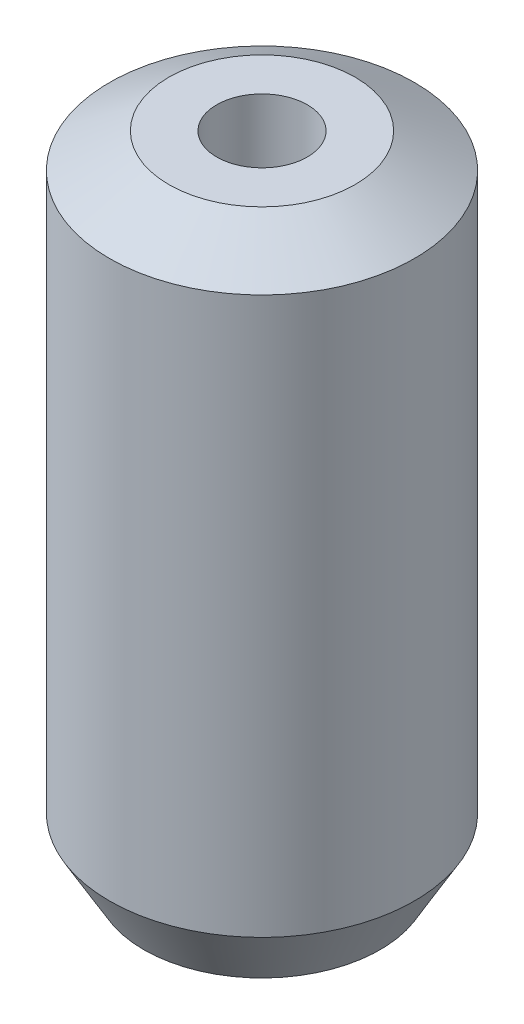
from build123d import *
from OCP.BRepFilletAPI import BRepFilletAPI_MakeChamfer

# Parameters (mm, degrees)
SKETCH1_R           = 12.5
BOSS_EXTRUDE1_DEPTH = 53.28529867
SKETCH2_R           = 3.714719022
CUT_EXTRUDE1_DEPTH  = 57.141099511
CHAMFER1_SIZE       = 2.810990905
CHAMFER1_SIZE2      = 4.868779068


with BuildPart() as part:
    # Sketch1 → Boss-Extrude1 (new body)
    with BuildSketch(Plane(origin=(0, 0, 0), x_dir=(1, 0, 0), z_dir=(0, 1, 0))):
        Circle(SKETCH1_R)
    extrude(amount=BOSS_EXTRUDE1_DEPTH)

    # Sketch2 → Cut-Extrude1 (cut, through all)
    with BuildSketch(Plane(origin=(0, 0, 0), x_dir=(1, 0, 0), z_dir=(0, 1, 0))):
        Circle(SKETCH2_R)
    extrude(amount=CUT_EXTRUDE1_DEPTH, mode=Mode.SUBTRACT)

    # Chamfer1: one chamfer whose edges measure the first distance from different faces: ONE call of the kernel's chamfer builder (chamfer() names one face for all edges)
    chamfer1_edges_1 = [part.edges().sort_by_distance(p)[0] for p in [
        (-12.5, 53.28529867, 0),
    ]]
    chamfer1_side_1 = [part.faces().sort_by_distance(p)[0] for p in [
        (-12.5, 26.642649335, 0),
    ]]
    chamfer1_edges_2 = [part.edges().sort_by_distance(p)[0] for p in [
        (-12.5, 0, 0),
    ]]
    chamfer1_side_2 = [part.faces().sort_by_distance(p)[0] for p in [
        (-12.146446609, 0, 0),
    ]]
    chamfer1 = BRepFilletAPI_MakeChamfer(part.part.solid().wrapped)
    for e in chamfer1_edges_1:
        chamfer1.Add(CHAMFER1_SIZE, CHAMFER1_SIZE2, e.wrapped, chamfer1_side_1[0].wrapped)  # the first distance lies on this face
    for e in chamfer1_edges_2:
        chamfer1.Add(CHAMFER1_SIZE, CHAMFER1_SIZE2, e.wrapped, chamfer1_side_2[0].wrapped)  # the first distance lies on this face
    add(Compound.cast(chamfer1.Shape()), mode=Mode.REPLACE)


solid = part.part
